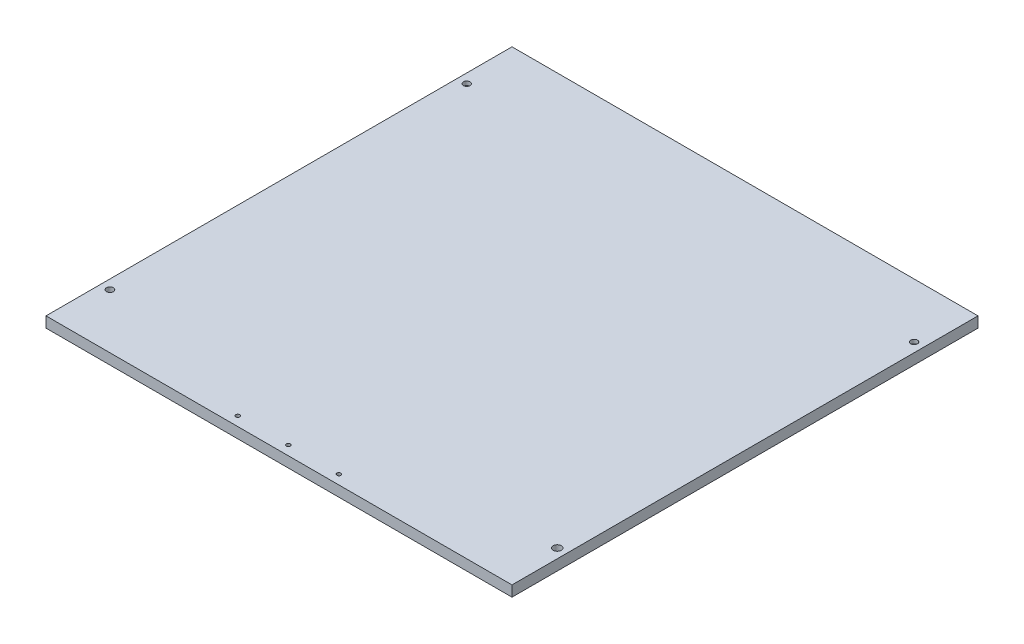
from build123d import *

# Parameters (mm, degrees)
PLATESKETCH2_W         = 350
PLATESKETCH2_H         = 350
PLATESKETCH2_R         = 1.5
PLATESKETCH2_R_2       = 2.599231227
PLATESKETCH2_R_3       = 3.021869548
BOSS_EXTRUDE1_DEPTH    = 8
BORESKETCH1_R          = 2.5
BORECUT_EXTRUDE1_DEPTH = 3


with BuildPart() as part:
    # PlateSketch2 → Boss-Extrude1 (new body)
    with BuildSketch(Plane(origin=(0, 0, 0), x_dir=(1, 0, 0), z_dir=(0, 1, 0))):
        with Locations((175, 175)):
            Rectangle(PLATESKETCH2_W, PLATESKETCH2_H)
        with Locations((7, 309)):
            Circle(PLATESKETCH2_R, mode=Mode.SUBTRACT)
        with Locations((343, 309)):
            Circle(PLATESKETCH2_R, mode=Mode.SUBTRACT)
        with Locations((137, 7)):
            Circle(PLATESKETCH2_R, mode=Mode.SUBTRACT)
        with Locations((175, 7)):
            Circle(PLATESKETCH2_R, mode=Mode.SUBTRACT)
        with Locations((213, 7)):
            Circle(PLATESKETCH2_R, mode=Mode.SUBTRACT)
        with Locations((7, 41)):
            Circle(PLATESKETCH2_R_2, mode=Mode.SUBTRACT)
        with Locations((343, 41)):
            Circle(PLATESKETCH2_R_3, mode=Mode.SUBTRACT)
    extrude(amount=BOSS_EXTRUDE1_DEPTH)

    # BoreSketch1 → BoreCut-Extrude1 (cut)
    with BuildSketch(Plane(origin=(0, 8, 0), x_dir=(1, 0, 0), z_dir=(0, 1, 0))):
        with Locations((7, 309)):
            Circle(BORESKETCH1_R)
        with Locations((343, 309)):
            Circle(BORESKETCH1_R)
    extrude(amount=-BORECUT_EXTRUDE1_DEPTH, mode=Mode.SUBTRACT)


solid = part.part
